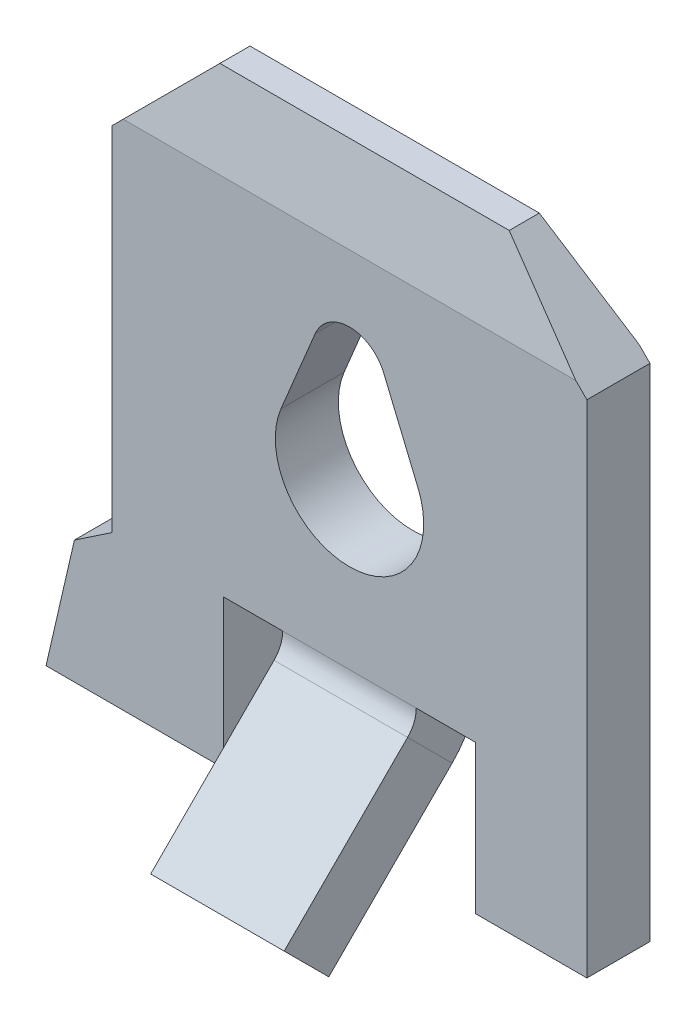
from build123d import *

# Parameters (mm, degrees)
BOSS_EXTRUDE1_DEPTH    = 6.4
CUT_EXTRUDE1_REACH     = 12.397
CUT_EXTRUDE2_DEPTH     = 0.85
SKETCH6_W              = 0.8
SKETCH6_H              = 2
CUT_EXTRUDE3_DEPTH     = 0.85
SKETCH7_W              = 1.8
SKETCH7_H              = 0.85
BOSS_EXTRUDE2_DEPTH    = 1
SKETCHED_START         = 2.3
SKETCHED_BEND1_DEPTH   = 1.8
SKETCHED_BEND1_2_DEPTH = 1.8
BOSS_EXTRUDE3_DEPTH    = 0.85


# Read off the part's stored shape, not the designer's step: Sketched Bend1
with BuildPart() as part:
    # Sketch1 → Boss-Extrude1 (new body)
    with BuildSketch(Plane(origin=(0, 0, 0), x_dir=(0, 0, -1), z_dir=(1, 0, 0))):
        Polygon((0, 0.15), (0, 7.05), (-0.241393443, 8.15), (-0.647131148, 8.15), (-0.85, 7.05), (-0.85, 0.15), align=None)
    extrude(amount=BOSS_EXTRUDE1_DEPTH)

    # Cut-Extrude1: up to this face of the body (flat: up to its plane)
    cut_extrude1_end = Plane(part.part.faces().sort_by_distance((3.2, 3.6, 0))[0])
    # Sketch4 → Cut-Extrude1 (cut, up to the picked face)
    with BuildSketch(Plane.XY.offset(0.85), mode=Mode.PRIVATE) as cut_extrude1_sk1:
        Polygon((0, 6.9), (1.25, 8.15), (0, 8.15), align=None)
    cut_extrude1_tool1 = split(extrude(cut_extrude1_sk1.sketch, amount=-CUT_EXTRUDE1_REACH, mode=Mode.PRIVATE), bisect_by=cut_extrude1_end, keep=Keep.BOTH, mode=Mode.PRIVATE)
    # Sketch4 → Cut-Extrude1 (cut, up to the picked face)
    with BuildSketch(Plane.XY.offset(0.85), mode=Mode.PRIVATE) as cut_extrude1_sk2:
        Polygon((5.15, 8.15), (6.4, 6.9), (6.4, 8.15), align=None)
    cut_extrude1_tool2 = split(extrude(cut_extrude1_sk2.sketch, amount=-CUT_EXTRUDE1_REACH, mode=Mode.PRIVATE), bisect_by=cut_extrude1_end, keep=Keep.BOTH, mode=Mode.PRIVATE)
    add(cut_extrude1_tool1.solids().sort_by(Axis((0.416667, 7.733333, 0.85), (0, 0, -1)))[0], mode=Mode.SUBTRACT)
    add(cut_extrude1_tool2.solids().sort_by(Axis((5.983333, 7.733333, 0.85), (0, 0, -1)))[0], mode=Mode.SUBTRACT)

    # Sketch5 → Cut-Extrude2 (cut)
    with BuildSketch(Plane.XY.offset(0.85)):
        with BuildLine():
            Line((2.738461538, 5.842307692), (2.276923077, 4.734615385))
            ThreePointArc((2.276923077, 4.734615385), (3.20010742, 3.350000006), (4.122994271, 4.734813689))
            Line((4.122994271, 4.734813689), (3.667436975, 5.827489929))
            ThreePointArc((3.667436975, 5.827489929), (3.207974312, 6.149936406), (2.738461538, 5.842307692))
        make_face()
    extrude(amount=-CUT_EXTRUDE2_DEPTH, mode=Mode.SUBTRACT)

    # Sketch6 → Cut-Extrude3 (cut)
    with BuildSketch(Plane(origin=(0, 0, 0), x_dir=(-1, 0, 0), z_dir=(0, 0, -1))):
        with Locations((-4.5, 1.15)):
            Rectangle(SKETCH6_W, SKETCH6_H)
        with Locations((-1.9, 1.15)):
            Rectangle(SKETCH6_W, SKETCH6_H)
    extrude(amount=-CUT_EXTRUDE3_DEPTH, mode=Mode.SUBTRACT)

    # Sketch7 → Boss-Extrude2 (add)
    with BuildSketch(Plane.XZ.offset(-0.15)):
        with Locations((3.2, 0.425)):
            Rectangle(SKETCH7_W, SKETCH7_H)
    extrude(amount=BOSS_EXTRUDE2_DEPTH)

    # Sketched Bend1 outline → Sketched Bend1 (cut)
    with BuildSketch(Plane.YZ.offset(SKETCHED_START)):
        with BuildLine():
            Line((1.266116524, 0.366116524), (0.782233048, 0.85))
            Line((0.782233048, 0.85), (-0.85, 0.85))
            Line((-0.85, 0.85), (-0.85, 0))
            Line((-0.85, 0), (2.15, 0))
            ThreePointArc((2.15, 0), (1.67164571, 0.095150584), (1.266116524, 0.366116524))
        make_face()
    extrude(amount=SKETCHED_BEND1_DEPTH, mode=Mode.SUBTRACT)

    # Sketched Bend1 2 outline → Sketched Bend1 2 (add)
    with BuildSketch(Plane.YZ.offset(SKETCHED_START)):
        with BuildLine():
            ThreePointArc((2.15, 0.85), (1.996926627, 0.880448187), (1.867157288, 0.967157288))
            Line((1.867157288, 0.967157288), (0.204009247, 2.630305328))
            Line((0.204009247, 2.630305328), (-0.397031517, 2.029264564))
            Line((-0.397031517, 2.029264564), (0.782233048, 0.85))
            Line((0.782233048, 0.85), (2.15, 0.85))
        make_face()
    extrude(amount=SKETCHED_BEND1_2_DEPTH)

    # Sketch15 → Boss-Extrude3 (add)
    with BuildSketch(Plane.XY.offset(0.85)):
        Polygon((0, 2.15), (-0.50789834, 1.808617859), (-0.890356386, 0.15), (0, 0.15), align=None)
    extrude(amount=-BOSS_EXTRUDE3_DEPTH)


solid = part.part
